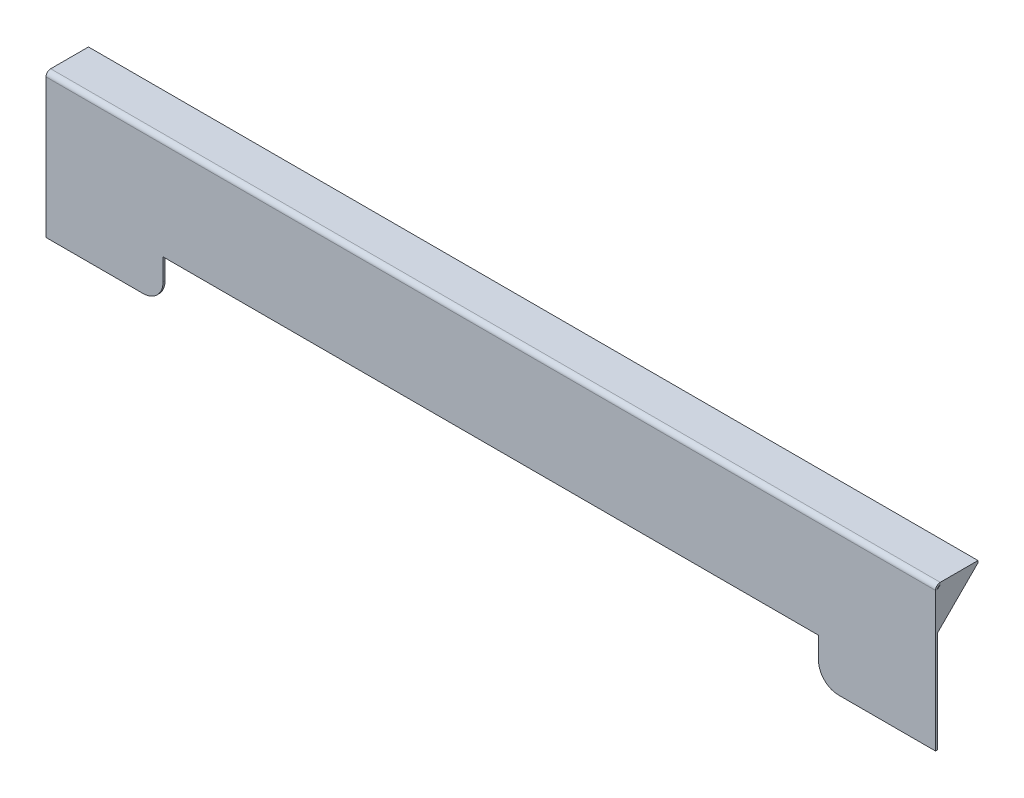
from build123d import *

# Parameters (mm, degrees)
RESSALTO_EXTRUS_O1_DEPTH       = 1.9
CONVERTER_S_LIDO1_DEPTH        = 0.7
ARESTA_FLANGE1_STRIP_W         = 8
ARESTA_FLANGE1_STRIP_H         = 1.2
ARESTA_FLANGE1_STRIP_CUT_DEPTH = 532
ARESTA_FLANGE1_DEPTH           = 532
RESSALTO_EXTRUS_O2_DEPTH       = 1.6


# Read off the part's stored shape, not the designer's step: Converter-Sólido1
# Sheet-metal steps are written as plain solids
with BuildPart() as part:
    # Esboço1 → Ressalto-extrusão1 (new body)
    with BuildSketch(Plane.XY):
        with BuildLine():
            Line((-266, -25), (-266, 61))
            Line((-266, 61), (266, 61))
            Line((266, 61), (266, -25))
            Line((266, -25), (208, -25))
            ThreePointArc((208, -25), (199.514718626, -21.485281374), (196, -13))
            Line((196, -13), (196, 0))
            Line((196, 0), (-196, 0))
            Line((-196, 0), (-196, -13))
            ThreePointArc((-196, -13), (-199.514718626, -21.485281374), (-208, -25))
            Line((-208, -25), (-266, -25))
        make_face()
    extrude(amount=RESSALTO_EXTRUS_O1_DEPTH)

    # Converter-Sólido1 outline → Converter-Sólido1 (cut)
    with BuildSketch(Plane.XY):
        with BuildLine():
            Line((-266, -25), (-208, -25))
            ThreePointArc((-208, -25), (-199.514718626, -21.485281374), (-196, -13))
            Line((-196, -13), (-196, 0))
            Line((-196, 0), (196, 0))
            Line((196, 0), (196, -13))
            ThreePointArc((196, -13), (199.514718626, -21.485281374), (208, -25))
            Line((208, -25), (266, -25))
            Line((266, -25), (266, 61))
            Line((266, 61), (-266, 61))
            Line((-266, 61), (-266, -25))
        make_face()
    extrude(amount=CONVERTER_S_LIDO1_DEPTH, mode=Mode.SUBTRACT)

    # Aresta-Flange1 strip (across the edge) → Aresta-Flange1 strip cut (cut)
    with BuildSketch(Plane(origin=(-266, 61, 0.7), x_dir=(0, -1, 0), z_dir=(1, 0, 0))):
        with Locations((-1.2, -0.6)):
            Rectangle(ARESTA_FLANGE1_STRIP_W, ARESTA_FLANGE1_STRIP_H)
    extrude(amount=ARESTA_FLANGE1_STRIP_CUT_DEPTH, mode=Mode.SUBTRACT)

    # Aresta-Flange1 section (across the edge) → Aresta-Flange1 (add)
    with BuildSketch(Plane(origin=(-266, 61, 0.7), x_dir=(0, -1, 0), z_dir=(1, 0, 0))):
        with BuildLine():
            Line((0, 1.6), (0, 24.2))
            Line((0, 24.2), (1.2, 24.2))
            Line((1.2, 24.2), (1.2, 1.6))
            ThreePointArc((1.2, 1.6), (1.66862915, 0.46862915), (2.8, 0))
            Line((2.8, 0), (2.8, -1.2))
            ThreePointArc((2.8, -1.2), (0.820101013, -0.379898987), (0, 1.6))
        make_face()
    extrude(amount=ARESTA_FLANGE1_DEPTH)

    # Esboço5 → Ressalto-extrusão2 (add)
    with BuildSketch(Plane(origin=(266, 0, 0), x_dir=(0, 0, -1), z_dir=(1, 0, 0))):
        Polygon((23.5, 59.8), (-0.7, 35.6), (-0.7, 58.2), (0.9, 59.8), align=None)
    extrude(amount=-RESSALTO_EXTRUS_O2_DEPTH)


solid = part.part
